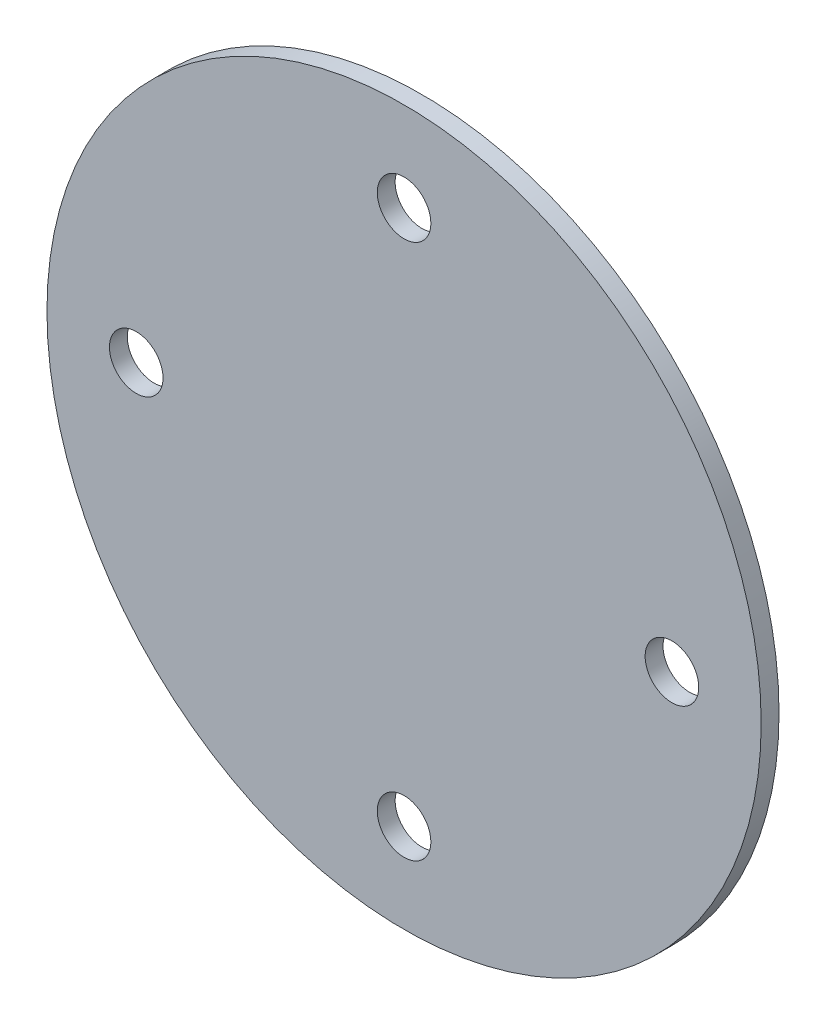
from build123d import *

# Parameters (mm, degrees)
SKETCH_1_R          = 40
EXTRUDE_1_DEPTH     = 2
SKETCH_2_R          = 3
CUT_EXTRUDE_1_DEPTH = 57.603886792


with BuildPart() as part:
    # 草图1 → 凸台-拉伸1 (new body)
    with BuildSketch(Plane.XY):
        Circle(SKETCH_1_R)
    extrude(amount=EXTRUDE_1_DEPTH)

    # 草图2 → 切除-拉伸1 (cut, through all)
    with BuildSketch(Plane.XY.offset(2)):
        with Locations((30, 0)):
            Circle(SKETCH_2_R)
        with Locations((0, 30)):
            Circle(SKETCH_2_R)
        with Locations((-30, 0)):
            Circle(SKETCH_2_R)
        with Locations((0, -30)):
            Circle(SKETCH_2_R)
    extrude(amount=-CUT_EXTRUDE_1_DEPTH, mode=Mode.SUBTRACT)


solid = part.part
